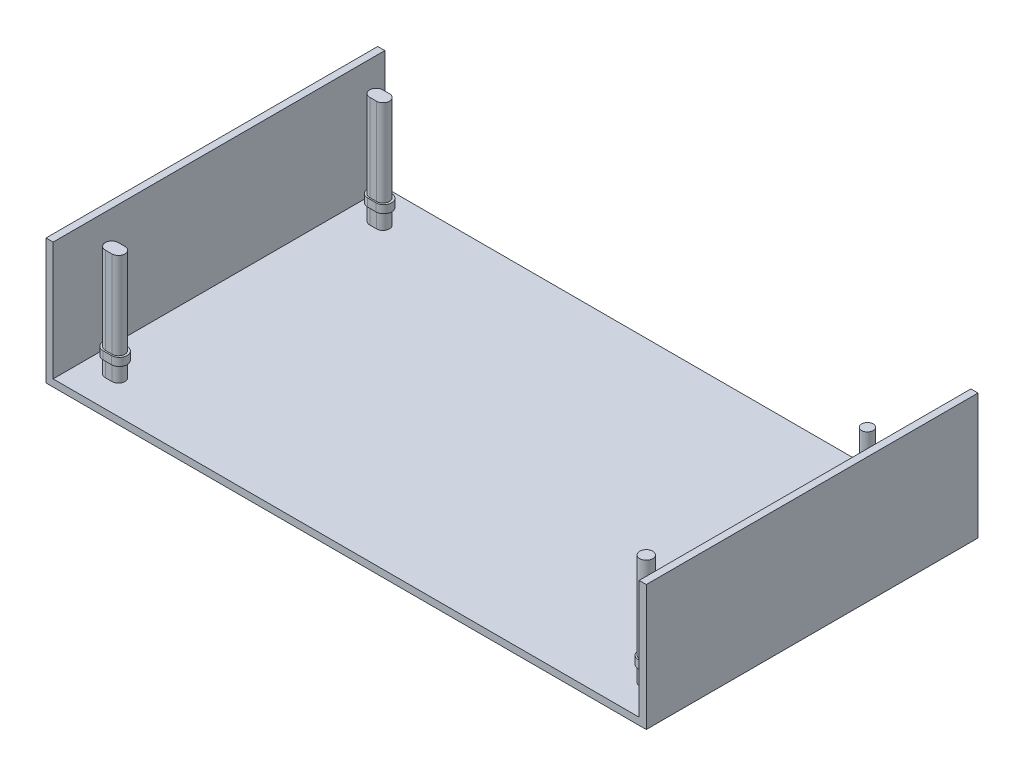
from build123d import *

# Parameters (mm, degrees)
SKETCH_1_W      = 152
SKETCH_1_H      = 84
EXTRUDE_1_DEPTH = 1.8
SKETCH_3_R      = 1.64
SKETCH_3_R_2    = 1.462072503
EXTRUDE_2_DEPTH = 28
SKETCH_3_2_R    = 1.64
SKETCH_3_2_R_2  = 1.462072503
EXTRUDE_3_DEPTH = 4.5
EXTRUDE_START   = -24
SKETCH_4_R      = 2
EXTRUDE_4_DEPTH = 2
SKETCH_10_W     = 1.8
SKETCH_10_H     = 84
EXTRUDE_6_DEPTH = 30


with BuildPart() as part:
    # 草图1 → 凸台-拉伸1 (new body)
    with BuildSketch(Plane(origin=(0, 0, 0), x_dir=(1, 0, 0), z_dir=(0, 1, 0))):
        with Locations((76, 42)):
            Rectangle(SKETCH_1_W, SKETCH_1_H)
    extrude(amount=EXTRUDE_1_DEPTH)

    # 草图3 → 凸台-拉伸2 (add)
    with BuildSketch(Plane(origin=(0, 1.8, 0), x_dir=(1, 0, 0), z_dir=(0, 1, 0))):
        with Locations((143.5, 8.5)):
            Circle(SKETCH_3_R)
        with Locations((143.5, 64.5)):
            Circle(SKETCH_3_R_2)
        with BuildLine():
            Line((8.15, 10.14), (9.85, 10.14))
            ThreePointArc((9.85, 10.14), (11.49, 8.5), (9.85, 6.86))
            Line((9.85, 6.86), (8.15, 6.86))
            ThreePointArc((8.15, 6.86), (6.51, 8.5), (8.15, 10.14))
        make_face()
        with BuildLine():
            Line((8.15, 73.84), (9.85, 73.84))
            ThreePointArc((9.85, 73.84), (11.49, 75.48), (9.85, 77.12))
            Line((9.85, 77.12), (8.15, 77.12))
            ThreePointArc((8.15, 77.12), (6.51, 75.48), (8.15, 73.84))
        make_face()
    extrude(amount=EXTRUDE_2_DEPTH)

    # 草图3<2> → 凸台-拉伸3 (add)
    with BuildSketch(Plane(origin=(0, 1.8, 0), x_dir=(1, 0, 0), z_dir=(0, 1, 0))):
        with Locations((143.5, 8.5)):
            Circle(SKETCH_3_2_R)
        with Locations((143.5, 64.5)):
            Circle(SKETCH_3_2_R_2)
        with BuildLine():
            Line((8.15, 10.14), (9.85, 10.14))
            ThreePointArc((9.85, 10.14), (11.49, 8.5), (9.85, 6.86))
            Line((9.85, 6.86), (8.15, 6.86))
            ThreePointArc((8.15, 6.86), (6.51, 8.5), (8.15, 10.14))
        make_face()
        with BuildLine():
            Line((8.15, 73.84), (9.85, 73.84))
            ThreePointArc((9.85, 73.84), (11.49, 75.48), (9.85, 77.12))
            Line((9.85, 77.12), (8.15, 77.12))
            ThreePointArc((8.15, 77.12), (6.51, 75.48), (8.15, 73.84))
        make_face()
    extrude(amount=EXTRUDE_3_DEPTH)

    # 草图4 → 凸台-拉伸4 (add)
    with BuildSketch(Plane(origin=(0, 29.8, 0), x_dir=(1, 0, 0), z_dir=(0, 1, 0)).offset(EXTRUDE_START)):
        with Locations((143.5, 64.5)):
            Circle(SKETCH_4_R)
        with Locations((143.5, 8.5)):
            Circle(SKETCH_4_R)
        with BuildLine():
            Line((7.952208314, 10.5), (10.047791686, 10.5))
            ThreePointArc((10.047791686, 10.5), (12.047791686, 8.5), (10.047791686, 6.5))
            Line((10.047791686, 6.5), (7.952208314, 6.5))
            ThreePointArc((7.952208314, 6.5), (5.952208314, 8.5), (7.952208314, 10.5))
        make_face()
        with BuildLine():
            Line((7.952208314, 73.5), (10.047791686, 73.5))
            ThreePointArc((10.047791686, 73.5), (12.047791686, 75.5), (10.047791686, 77.5))
            Line((10.047791686, 77.5), (7.952208314, 77.5))
            ThreePointArc((7.952208314, 77.5), (5.952208314, 75.5), (7.952208314, 73.5))
        make_face()
    extrude(amount=EXTRUDE_4_DEPTH)

    # 草图10 → 凸台-拉伸6 (add)
    with BuildSketch(Plane(origin=(0, 1.8, 0), x_dir=(1, 0, 0), z_dir=(0, 1, 0))):
        with Locations((0.9, 42)):
            Rectangle(SKETCH_10_W, SKETCH_10_H)
        with Locations((151.1, 42)):
            Rectangle(SKETCH_10_W, SKETCH_10_H)
    extrude(amount=EXTRUDE_6_DEPTH)


solid = part.part
